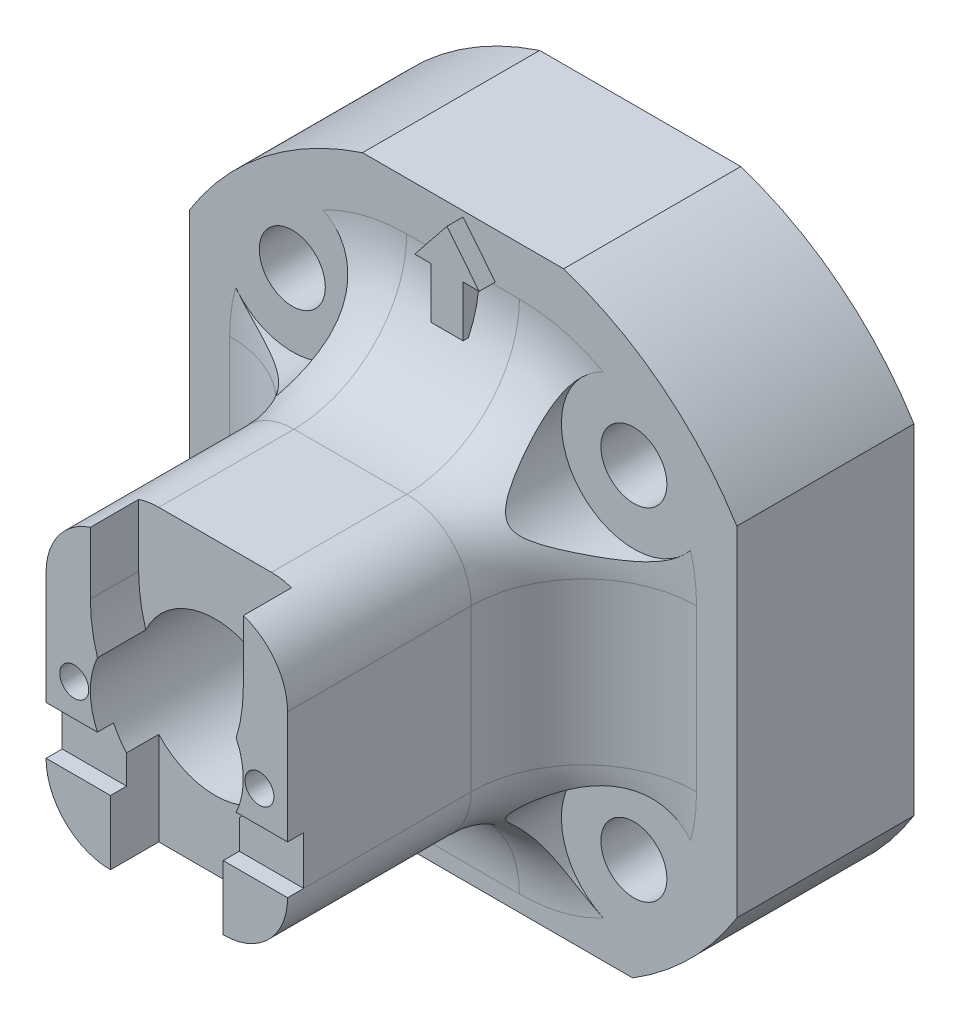
from build123d import *

# Parameters (mm, degrees)
SKETCH1_R           = 20
SKETCH1_R_2         = 4.75
BOSS_EXTRUDE1_DEPTH = 11
SKETCH2_W           = 13.186598354
SKETCH2_H           = 1
SKETCH2_W_2         = 3
SKETCH2_H_2         = 26.426474467
SKETCH2_H_3         = 26.621798467
SKETCH2_W_3         = 38.736212376
SKETCH2_H_4         = 3
CUT_EXTRUDE1_DEPTH  = 31.347981811
SKETCH3_R           = 2.05
CUT_EXTRUDE2_DEPTH  = 28.766886754
SKETCH5_R           = 0.9
BOSS_EXTRUDE2_DEPTH = 18.4
SKETCH13_R          = 0.9
BOSS_EXTRUDE3_DEPTH = 8.4
SKETCH7_W           = 18.227706113
SKETCH7_H           = 3
CUT_EXTRUDE4_DEPTH  = 1
FILLET1_R           = 7
SKETCH9_R           = 4.5
CUT_EXTRUDE5_DEPTH  = 32.441374016
SKETCH10_R          = 4.75
CUT_EXTRUDE6_DEPTH  = 39.914778684
SKETCH11_W          = 9.5
SKETCH11_H          = 3
CUT_EXTRUDE7_DEPTH  = 7
SKETCH12_R          = 6
CUT_EXTRUDE8_DEPTH  = 14.4
CHAMFER2_SIZE       = 1.5
CHAMFER1_SIZE       = 4
CHAMFER1_SIZE2      = 4.76701437
FILLET2_R           = 10
SKETCH14_W          = 7
SKETCH14_H          = 3
CUT_EXTRUDE9_DEPTH  = 10
BOSS_EXTRUDE4_DEPTH = 1


with BuildPart() as part:
    # Sketch1 → Boss-Extrude1 (new body)
    with BuildSketch(Plane.XY):
        Circle(SKETCH1_R)
        Circle(SKETCH1_R_2, mode=Mode.SUBTRACT)
    extrude(amount=BOSS_EXTRUDE1_DEPTH)

    # Sketch2 → Cut-Extrude1 (cut, through all)
    with BuildSketch(Plane.XY.offset(11)):
        with Locations((0, 19.5)):
            Rectangle(SKETCH2_W, SKETCH2_H)
        with Locations((-18.5, 2.677583481)):
            Rectangle(SKETCH2_W_2, SKETCH2_H_2)
        with Locations((18.5, -1.585343055)):
            Rectangle(SKETCH2_W_2, SKETCH2_H_3)
        with Locations((0.423755219, -18.5)):
            Rectangle(SKETCH2_W_3, SKETCH2_H_4)
    extrude(amount=-CUT_EXTRUDE1_DEPTH, mode=Mode.SUBTRACT)

    # Sketch3 → Cut-Extrude2 (cut, through all)
    with BuildSketch(Plane.XY.offset(11)):
        with Locations((-10.606601718, -10.606601718)):
            Circle(SKETCH3_R)
        with Locations((-10.606601718, 10.606601718)):
            Circle(SKETCH3_R)
        with Locations((10.606601718, 10.606601718)):
            Circle(SKETCH3_R)
        with Locations((10.606601718, -10.606601718)):
            Circle(SKETCH3_R)
    extrude(amount=-CUT_EXTRUDE2_DEPTH, mode=Mode.SUBTRACT)

    # Sketch5 → Boss-Extrude2 (add)
    with BuildSketch(Plane.XY.offset(11)):
        with BuildLine():
            Line((7.5, -5), (7.5, 5))
            ThreePointArc((7.5, 5), (6.328427125, 7.828427125), (3.5, 9))
            Line((3.5, 9), (-3.5, 9))
            ThreePointArc((-3.5, 9), (-6.328427125, 7.828427125), (-7.5, 5))
            Line((-7.5, 5), (-7.5, -5))
            ThreePointArc((-7.5, -5), (-6.328427125, -7.828427125), (-3.5, -9))
            Line((-3.5, -9), (3.5, -9))
            ThreePointArc((3.5, -9), (6.328427125, -7.828427125), (7.5, -5))
        make_face()
        with Locations(Location((-5.75, 0, 0), (0, 0, 180))):
            Circle(SKETCH5_R, mode=Mode.SUBTRACT)
        with Locations(Location((5.75, 0, 0), (0, 0, 180))):
            Circle(SKETCH5_R, mode=Mode.SUBTRACT)
    extrude(amount=BOSS_EXTRUDE2_DEPTH)

    # Sketch13 → Boss-Extrude3 (add)
    with BuildSketch(Plane.XY.offset(11)):
        with Locations(Location((5.75, 0, 0), (0, 0, 180))):
            Circle(SKETCH13_R)
        with Locations(Location((-5.75, 0, 0), (0, 0, 180))):
            Circle(SKETCH13_R)
    extrude(amount=BOSS_EXTRUDE3_DEPTH)

    # Sketch7 → Cut-Extrude4 (cut)
    with BuildSketch(Plane.XY.offset(29.4)):
        with Locations((0.270040091, -3.5)):
            Rectangle(SKETCH7_W, SKETCH7_H)
    extrude(amount=-CUT_EXTRUDE4_DEPTH, mode=Mode.SUBTRACT)

    # Fillet1
    # the kernel refuses this fillet: 7 mm, written as the material it adds along each edge
    with BuildSketch(Plane(origin=(-3.5, -9, 11), x_dir=(0, -1, 0), z_dir=(1, 0, 0)), Plane(origin=(3.5, 9, 11), x_dir=(0, 1, 0), z_dir=(-1, 0, 0))) as fillet1_piece_1:
        with BuildLine():
            CenterArc((FILLET1_R, -FILLET1_R), FILLET1_R, 90, 90)
            Line((0, -FILLET1_R), (0, 0))
            Line((0, 0), (FILLET1_R, 0))
        make_face()
    extrude(amount=7)
    with BuildSketch(Plane(origin=(-3.5, -5, 11), x_dir=(-1, 0, 0), z_dir=(0, 1, 0))) as fillet1_piece_2_section:
        with BuildLine():
            CenterArc((4 + FILLET1_R, FILLET1_R), FILLET1_R, 180, 90)
            Line((4, FILLET1_R), (4, 0))
            Line((4, 0), (4 + FILLET1_R, 0))
        make_face()
    fillet1_piece_2 = revolve(axis=Axis((-3.5, -5, 11), (0, 0, 1)), revolution_arc=90, mode=Mode.PRIVATE)
    fillet1_piece_2 = fillet1_piece_2 - Plane(origin=(-10.606601718, -10.606601718, 12.414511809), x_dir=(1, 0, 0), z_dir=(0, 0, 1)) * Cylinder(2.05, 44, mode=Mode.PRIVATE)
    add(fillet1_piece_2)
    with BuildSketch(Plane(origin=(-7.5, 5, 11), x_dir=(-1, 0, 0), z_dir=(0, -1, 0)), Plane(origin=(7.5, -5, 11), x_dir=(1, 0, 0), z_dir=(0, 1, 0))) as fillet1_piece_3:
        with BuildLine():
            CenterArc((FILLET1_R, -FILLET1_R), FILLET1_R, 90, 90)
            Line((0, -FILLET1_R), (0, 0))
            Line((0, 0), (FILLET1_R, 0))
        make_face()
    extrude(amount=10)
    with BuildSketch(Plane(origin=(-3.5, 5, 11), x_dir=(0, 1, 0), z_dir=(1, 0, 0))) as fillet1_piece_4_section:
        with BuildLine():
            CenterArc((4 + FILLET1_R, FILLET1_R), FILLET1_R, 180, 90)
            Line((4, FILLET1_R), (4, 0))
            Line((4, 0), (4 + FILLET1_R, 0))
        make_face()
    fillet1_piece_4 = revolve(axis=Axis((-3.5, 5, 11), (0, 0, 1)), revolution_arc=90, mode=Mode.PRIVATE)
    fillet1_piece_4 = fillet1_piece_4 - Plane(origin=(-10.606601718, 10.606601718, 12.41451172), x_dir=(1, 0, 0), z_dir=(0, 0, 1)) * Cylinder(2.05, 44, mode=Mode.PRIVATE)
    add(fillet1_piece_4)
    with BuildSketch(Plane(origin=(3.5, 5, 11), x_dir=(1, 0, 0), z_dir=(0, -1, 0))) as fillet1_piece_5_section:
        with BuildLine():
            CenterArc((4 + FILLET1_R, FILLET1_R), FILLET1_R, 180, 90)
            Line((4, FILLET1_R), (4, 0))
            Line((4, 0), (4 + FILLET1_R, 0))
        make_face()
    fillet1_piece_5 = revolve(axis=Axis((3.5, 5, 11), (0, 0, 1)), revolution_arc=90, mode=Mode.PRIVATE)
    fillet1_piece_5 = fillet1_piece_5 - Plane(origin=(10.606601718, 10.606601718, 12.414511728), x_dir=(1, 0, 0), z_dir=(0, 0, 1)) * Cylinder(2.05, 44, mode=Mode.PRIVATE)
    add(fillet1_piece_5)
    with BuildSketch(Plane(origin=(3.5, -5, 11), x_dir=(0, -1, 0), z_dir=(-1, 0, 0))) as fillet1_piece_6_section:
        with BuildLine():
            CenterArc((4 + FILLET1_R, FILLET1_R), FILLET1_R, 180, 90)
            Line((4, FILLET1_R), (4, 0))
            Line((4, 0), (4 + FILLET1_R, 0))
        make_face()
    fillet1_piece_6 = revolve(axis=Axis((3.5, -5, 11), (0, 0, 1)), revolution_arc=90, mode=Mode.PRIVATE)
    fillet1_piece_6 = fillet1_piece_6 - Plane(origin=(10.606601718, -10.606601718, 12.4145119), x_dir=(1, 0, 0), z_dir=(0, 0, 1)) * Cylinder(2.05, 44, mode=Mode.PRIVATE)
    add(fillet1_piece_6)

    # Sketch9 → Cut-Extrude5 (cut, through all)
    with BuildSketch(Plane.XY.offset(11)):
        with Locations((10.606601718, 10.606601718)):
            Circle(SKETCH9_R)
        with Locations((10.606601718, -10.606601718)):
            Circle(SKETCH9_R)
        with Locations((-10.606601718, -10.606601718)):
            Circle(SKETCH9_R)
        with Locations((-10.606601718, 10.606601718)):
            Circle(SKETCH9_R)
    extrude(amount=CUT_EXTRUDE5_DEPTH, mode=Mode.SUBTRACT)

    # Sketch10 → Cut-Extrude6 (cut, through all)
    with BuildSketch(Plane(origin=(0, 0, 0), x_dir=(-1, 0, 0), z_dir=(0, 0, -1))):
        with Locations(Location((0, 0, 0), (0, 0, 335.09893763))):
            Circle(SKETCH10_R)
    extrude(amount=-CUT_EXTRUDE6_DEPTH, mode=Mode.SUBTRACT)

    # Sketch11 → Cut-Extrude7 (cut)
    with BuildSketch(Plane(origin=(0, 9, 0), x_dir=(1, 0, 0), z_dir=(0, 1, 0))):
        with Locations((0, -27.9)):
            Rectangle(SKETCH11_W, SKETCH11_H)
    extrude(amount=-CUT_EXTRUDE7_DEPTH, mode=Mode.SUBTRACT)

    # Sketch12 → Cut-Extrude8 (cut)
    with BuildSketch(Plane(origin=(0, 0, 0), x_dir=(-1, 0, 0), z_dir=(0, 0, -1))):
        Circle(SKETCH12_R)
    extrude(amount=-CUT_EXTRUDE8_DEPTH, mode=Mode.SUBTRACT)

    # Chamfer2
    # the kernel refuses this chamfer: 1.5 mm, written as the material it adds along each edge
    with BuildSketch(Plane(origin=(0, 0, 14.4), x_dir=(-1, 0, 0), z_dir=(0, -1, 0))) as chamfer2_piece_1_section:
        Polygon((6, CHAMFER2_SIZE), (6 - CHAMFER2_SIZE, 0), (6, 0), align=None)
    chamfer2_piece_1 = revolve(axis=Axis((0, 0, 14.4), (0, 0, -1)), mode=Mode.PRIVATE)
    chamfer2_piece_1 = chamfer2_piece_1 - Plane(origin=(0, 0, 13.528251252), x_dir=(-0.9070362073508065, -0.4210526315731381, 0), z_dir=(0, 0, -1)) * Cylinder(4.75, 24, mode=Mode.PRIVATE)
    add(chamfer2_piece_1)

    # Chamfer1
    chamfer1_edges = [part.edges().sort_by_distance(p)[0] for p in [
        (6, 0, 0),
    ]]
    chamfer1_side = [part.faces().sort_by_distance(p)[0] for p in [
        (16.504823264, 0, 0),
    ]]
    chamfer(chamfer1_edges, length=CHAMFER1_SIZE, length2=CHAMFER1_SIZE2, reference=chamfer1_side[0])

    # Fillet2
    # the kernel refuses this fillet: 10 mm, written as the material it adds along each edge
    with BuildSketch(Plane(origin=(4.75, 2, 29.4), x_dir=(-1, 0, 0), z_dir=(0, 0, -1)), Plane(origin=(-4.75, 2, 19.052989911), x_dir=(1, 0, 0), z_dir=(0, 0, 1))) as fillet2_piece_1:
        with BuildLine():
            CenterArc((10, 2.938804035), FILLET2_R, 180, 17.090413612)
            Line((0, 2.938804035), (-0.2, 2.938804035))
            Line((-0.2, 2.938804035), (-0.2, 0))
            Line((-0.2, 0), (0, -0.2))
            ThreePointArc((0, -0.2), (0.220789008, -0.2), (0.250409575, -0.058776081))
            Line((0.250409575, -0.058776081), (0.441578015, 0))
        make_face()
    extrude(amount=10.347010089)

    # Sketch14 → Cut-Extrude9 (cut)
    with BuildSketch(Plane.XZ.offset(9)):
        with Locations((0, 27.9)):
            Rectangle(SKETCH14_W, SKETCH14_H)
    extrude(amount=-CUT_EXTRUDE9_DEPTH, mode=Mode.SUBTRACT)

    # Sketch15 → Boss-Extrude4 (add)
    with BuildSketch(Plane.XY.offset(11)):
        Polygon((-1, 13.002035862), (1, 13.002035862), (1, 16.164200489), (2, 16.164200489), (0, 18.664200489), (-2, 16.164200489), (-1, 16.164200489), align=None)
    extrude(amount=BOSS_EXTRUDE4_DEPTH)


solid = part.part
